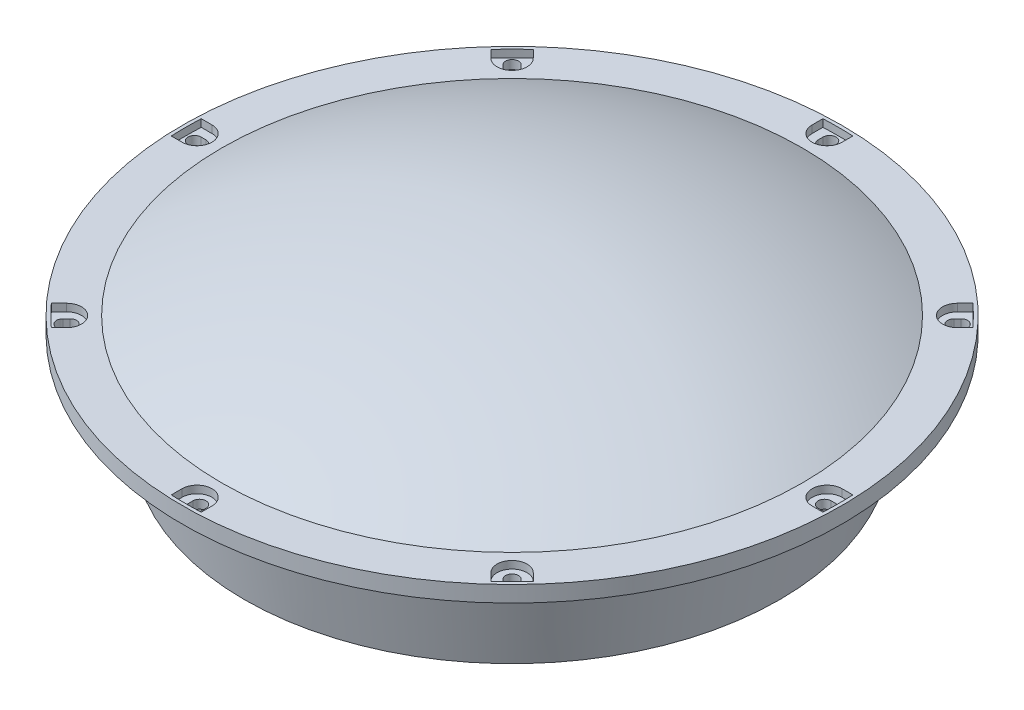
from build123d import *

# Parameters (mm, degrees)
CUT_EXTRUDE1_DEPTH       = 3
FILLET1_R                = 6
CUT_EXTRUDE2_DEPTH       = 192.342624629
CIRPATTERN2_COUNT        = 8
FILLET1_OF_CIRPATTERN2_R = 6


with BuildPart() as part:
    # Sketch1 → Revolve1 (revolve)
    with BuildSketch(Plane.XY, mode=Mode.PRIVATE) as revolve1_sk:
        with BuildLine():
            Line((116.25, 45), (132, 45))
            Line((132, 45), (132, 38.55))
            Line((132, 38.55), (114, 38.55))
            Line((114, 38.55), (107.202594894, 0))
            Line((107.202594894, 0), (0, 0))
            Line((0, 0), (0, 73.7))
            ThreePointArc((0, 73.7), (59.870177259, 66.418880012), (116.25, 45))
        make_face()
    revolve(revolve1_sk.sketch.rotate(Axis((0, 0, 0), (0, 1, 0)), 90), axis=Axis((0, 0, 0), (0, 1, 0)))

    # Sketch2 → Cut-Extrude1 (cut)
    with BuildSketch(Plane(origin=(0, 45, 0), x_dir=(1, 0, 0), z_dir=(0, 1, 0))):
        with BuildLine():
            Line((130.492133479, 6), (120.18, 6))
            Line((120.18, 6), (120.18, -6))
            Line((120.18, -6), (130.492133479, -6))
            ThreePointArc((130.492133479, -6), (130.63, 0), (130.492133479, 6))
        make_face()
    cut_extrude1 = extrude(amount=-CUT_EXTRUDE1_DEPTH, mode=Mode.SUBTRACT)

    # Fillet1
    fillet1_edges = [part.edges().sort_by_distance(p)[0] for p in [
        (120.18, 43.5, 6),
        (120.18, 43.5, -6),
    ]]
    fillet(fillet1_edges, radius=FILLET1_R - 0.0001)  # a hair under: the kernel refuses the full size

    # Sketch3 → Cut-Extrude2 (cut, through all)
    with BuildSketch(Plane(origin=(0, 42, 0), x_dir=(1, 0, 0), z_dir=(0, 1, 0))):
        with BuildLine():
            Line((125.18, 2.6), (127.18, 2.6))
            ThreePointArc((127.18, 2.6), (129.78, 0), (127.18, -2.6))
            Line((127.18, -2.6), (125.18, -2.6))
            ThreePointArc((125.18, -2.6), (122.58, 0), (125.18, 2.6))
        make_face()
    cut_extrude2 = extrude(amount=-CUT_EXTRUDE2_DEPTH, mode=Mode.SUBTRACT)

    # CirPattern2: Cut-Extrude1, Cut-Extrude2 ×8 about axis
    cirpattern2_axis = Axis((0, 0, 0), (0, 1, 0))
    add([cut_extrude1.rotate(cirpattern2_axis, i * 360 / CIRPATTERN2_COUNT) for i in range(1, CIRPATTERN2_COUNT)], mode=Mode.SUBTRACT)
    add([cut_extrude2.rotate(cirpattern2_axis, i * 360 / CIRPATTERN2_COUNT) for i in range(1, CIRPATTERN2_COUNT)], mode=Mode.SUBTRACT)

    # Fillet1 of CirPattern2
    fillet1_of_cirpattern2_edges = [part.edges().sort_by_distance(p)[0] for p in [
        (89.22273365, 43.5, -80.737452276),
        (80.737452276, 43.5, -89.22273365),
        (6, 43.5, -120.18),
        (-6, 43.5, -120.18),
        (-80.737452276, 43.5, -89.22273365),
        (-89.22273365, 43.5, -80.737452276),
        (-120.18, 43.5, -6),
        (-120.18, 43.5, 6),
        (-89.22273365, 43.5, 80.737452276),
        (-80.737452276, 43.5, 89.22273365),
        (-6, 43.5, 120.18),
        (6, 43.5, 120.18),
        (80.737452276, 43.5, 89.22273365),
        (89.22273365, 43.5, 80.737452276),
    ]]
    fillet(fillet1_of_cirpattern2_edges, radius=FILLET1_OF_CIRPATTERN2_R - 0.0001)  # a hair under: the kernel refuses the full size


solid = part.part
